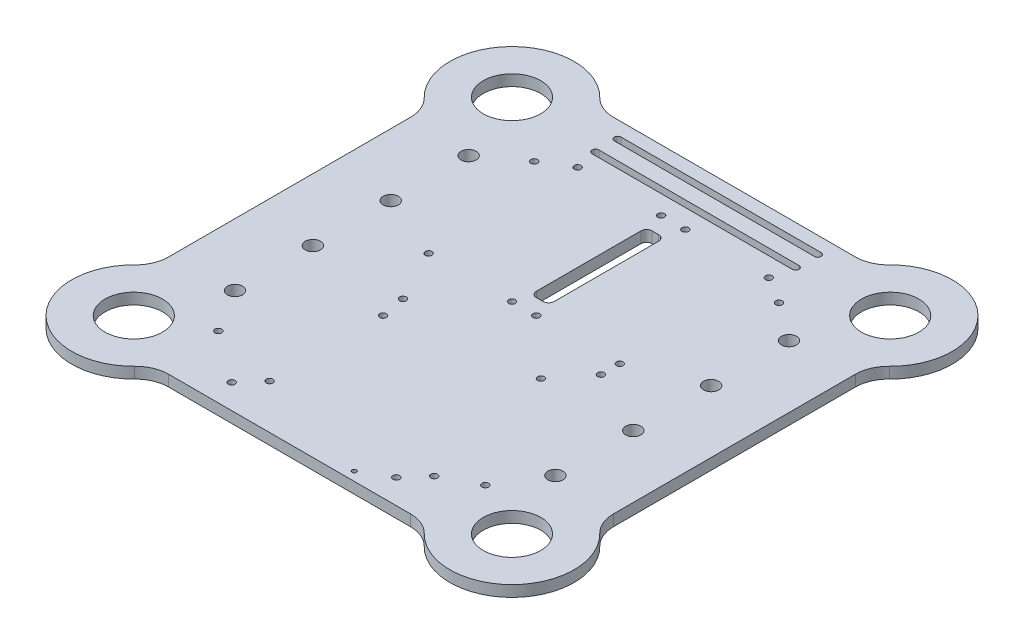
from build123d import *

# Parameters (mm, degrees)
SKETCH1_R          = 12.9
BASE_DEPTH         = 5
SKETCH2_R          = 1.5
SKETCH2_R_2        = 3.4
SKETCH2_R_3        = 1
CUT_EXTRUDE1_DEPTH = 160.742981066
CUT_EXTRUDE2_DEPTH = 160.742981066
SKETCH4_R          = 1.5
CUT_EXTRUDE3_DEPTH = 160.742981066


with BuildPart() as part:
    # Sketch1 → Base (new body)
    with BuildSketch(Plane(origin=(0, 0, 0), x_dir=(1, 0, 0), z_dir=(0, 1, 0))):
        with BuildLine():
            Line((0, 100), (54.333894933, 100))
            ThreePointArc((54.333894933, 100), (60.150136961, 101.173527975), (65.056309292, 104.51048951))
            ThreePointArc((65.056309292, 104.51048951), (104.728279195, 104.728279195), (104.51048951, 65.056309292))
            ThreePointArc((104.51048951, 65.056309292), (101.173527975, 60.150136961), (100, 54.333894933))
            Line((100, 54.333894933), (100, -54.333894933))
            ThreePointArc((100, -54.333894933), (101.173527975, -60.150136961), (104.51048951, -65.056309292))
            ThreePointArc((104.51048951, -65.056309292), (104.728279195, -104.728279195), (65.056309292, -104.51048951))
            ThreePointArc((65.056309292, -104.51048951), (60.150136961, -101.173527975), (54.333894933, -100))
            Line((54.333894933, -100), (0, -100))
            Line((0, -100), (0, 81))
            Line((0, 81), (45, 81))
            ThreePointArc((45, 81), (46.5, 82.5), (45, 84))
            Line((45, 84), (0, 84))
            Line((0, 84), (0, 91))
            Line((0, 91), (45, 91))
            ThreePointArc((45, 91), (46.5, 92.5), (45, 94))
            Line((45, 94), (0, 94))
            Line((0, 94), (0, 100))
        make_face()
        with Locations((85, 85)):
            Circle(SKETCH1_R, mode=Mode.SUBTRACT)
        with Locations((85, -85)):
            Circle(SKETCH1_R, mode=Mode.SUBTRACT)
    base = extrude(amount=BASE_DEPTH)

    # Mirror1: Base across plane
    add(base.mirror(Plane(origin=(0, 0, 0), x_dir=(0, 0, 1), z_dir=(1, 0, 0))))

    # Sketch2 → Cut-Extrude1 (cut, through all)
    with BuildSketch(Plane(origin=(0, 5, 0), x_dir=(1, 0, 0), z_dir=(0, 1, 0))):
        with Locations((-42.960009902, 72.46)):
            Circle(SKETCH2_R)
        with Locations((-5.460009902, 72.46)):
            Circle(SKETCH2_R)
        with Locations((5.460009902, 72.46)):
            Circle(SKETCH2_R)
        with Locations((42.960009902, 72.46)):
            Circle(SKETCH2_R)
        with Locations((72.009618943, 52.5)):
            Circle(SKETCH2_R_2)
        with Locations((-28.986150524, -79.986157497)):
            Circle(SKETCH2_R)
        with Locations((72.009618943, -17.5)):
            Circle(SKETCH2_R_2)
        with Locations((72.009618943, -52.5)):
            Circle(SKETCH2_R_2)
        with Locations((42.960009902, 5.46)):
            Circle(SKETCH2_R)
        with Locations((42.960009902, -2.986157497)):
            Circle(SKETCH2_R)
        with Locations((5.460009902, 5.46)):
            Circle(SKETCH2_R)
        with Locations((-5.460009902, 5.46)):
            Circle(SKETCH2_R)
        with Locations((-28.986150524, -28.986157497)):
            Circle(SKETCH2_R)
        with Locations((-42.960009902, 5.46)):
            Circle(SKETCH2_R)
        with Locations((-72.009618943, 52.5)):
            Circle(SKETCH2_R_2)
        with Locations((-72.009618943, -17.5)):
            Circle(SKETCH2_R_2)
        with Locations((-72.009618943, -52.5)):
            Circle(SKETCH2_R_2)
        with Locations((45.013849476, -79.986157497)):
            Circle(SKETCH2_R)
        with Locations((36.999763655, -89)):
            Circle(SKETCH2_R)
        with Locations((-37.000236345, -89)):
            Circle(SKETCH2_R)
        with Locations((-72.009618943, 17.5)):
            Circle(SKETCH2_R_2)
        with Locations((72.009618943, 17.5)):
            Circle(SKETCH2_R_2)
        with Locations((25.1, -96)):
            Circle(SKETCH2_R_3)
    extrude(amount=-CUT_EXTRUDE1_DEPTH, mode=Mode.SUBTRACT)

    # Sketch3 → Cut-Extrude2 (cut, through all)
    with BuildSketch(Plane(origin=(0, 5, 0), x_dir=(1, 0, 0), z_dir=(0, 1, 0))):
        with BuildLine():
            Line((0, 64.46), (1.5, 64.46))
            ThreePointArc((1.5, 64.46), (3.267766953, 63.727766953), (4, 61.96))
            Line((4, 61.96), (4, 14.96))
            ThreePointArc((4, 14.96), (3.267766953, 13.192233047), (1.5, 12.46))
            Line((1.5, 12.46), (-1.5, 12.46))
            ThreePointArc((-1.5, 12.46), (-3.267766953, 13.192233047), (-4, 14.96))
            Line((-4, 14.96), (-4, 61.96))
            ThreePointArc((-4, 61.96), (-3.267766953, 63.727766953), (-1.5, 64.46))
            Line((-1.5, 64.46), (0, 64.46))
        make_face()
    extrude(amount=-CUT_EXTRUDE2_DEPTH, mode=Mode.SUBTRACT)

    # Sketch4 → Cut-Extrude3 (cut, through all)
    with BuildSketch(Plane(origin=(0, 5, 0), x_dir=(1, 0, 0), z_dir=(0, 1, 0))):
        with Locations((-55.009618943, 65)):
            Circle(SKETCH4_R)
        with Locations((55.009618943, 65)):
            Circle(SKETCH4_R)
        with Locations((-60.009618943, -72)):
            Circle(SKETCH4_R)
        with Locations((60.009618943, -72)):
            Circle(SKETCH4_R)
        with Locations((31.009618943, -18)):
            Circle(SKETCH4_R)
        with Locations((-31.009618943, -18)):
            Circle(SKETCH4_R)
    extrude(amount=-CUT_EXTRUDE3_DEPTH, mode=Mode.SUBTRACT)


solid = part.part
